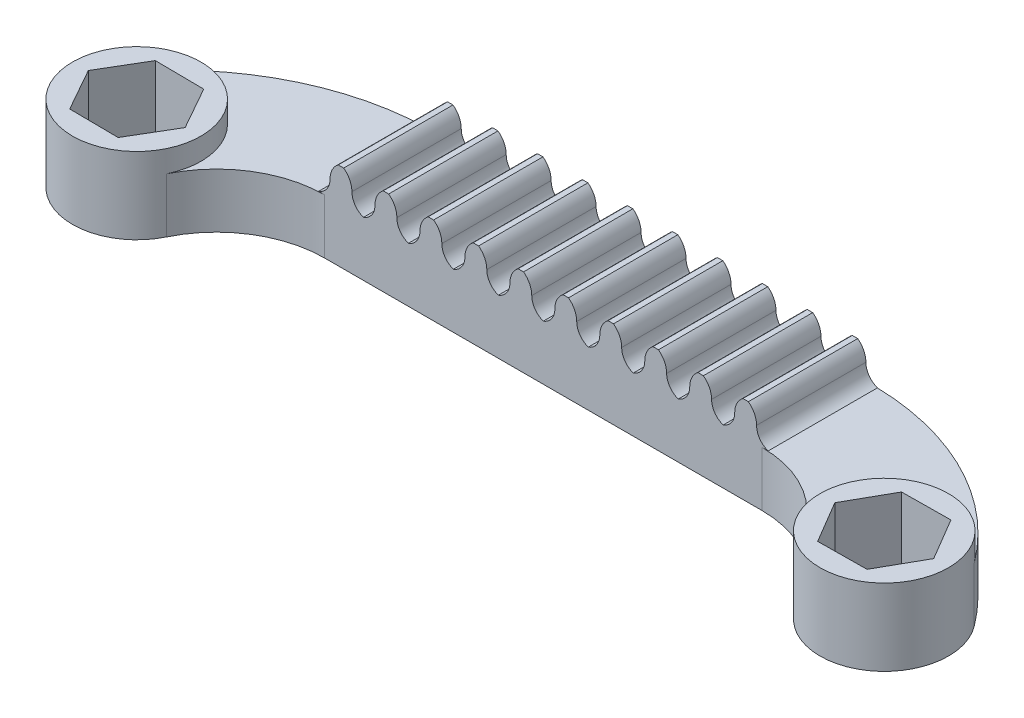
from build123d import *

# Parameters (mm, degrees)
BOSS_EXTRUDE1_DEPTH             = 5
BOSS_EXTRUDE2_REACH             = 44.693
SKETCH2_W                       = 1
SKETCH2_H                       = 1.5
BOSS_EXTRUDE2_DIRECTION_2_REACH = 44.693
LPATTERN1_COUNT                 = 10
LPATTERN1_PITCH                 = 4.112759299
BOSS_EXTRUDE3_START             = 5
BOSS_EXTRUDE3_OUTLINE_R         = 5.875
BOSS_EXTRUDE3_DEPTH             = 2


# Read off the part's stored shape, not the designer's step: Boss-Extrude3
with BuildPart() as part:
    # Sketch1 → Boss-Extrude1 (new body)
    with BuildSketch(Plane(origin=(0, 0, 0), x_dir=(1, 0, 0), z_dir=(0, 1, 0))):
        with BuildLine():
            ThreePointArc((-38.901886937, -4.490905174), (-37.243453661, -13.019167833), (-28.907471708, -10.571093123))
            ThreePointArc((-28.907471708, -10.571093123), (-25.253097439, -6.507468715), (-20, -5))
            Line((-20, -5), (20, -5))
            ThreePointArc((20, -5), (25.253097439, -6.507468715), (28.907471708, -10.571093123))
            ThreePointArc((28.907471708, -10.571093123), (37.243453661, -13.019167833), (38.901886937, -4.490905174))
            ThreePointArc((38.901886937, -4.490905174), (30.575426833, 2.494044808), (20, 5))
            Line((20, 5), (-20, 5))
            ThreePointArc((-20, 5), (-30.575426833, 2.494044808), (-38.901886937, -4.490905174))
        make_face()
        Polygon((-31.913207445, -4.148110984), (-30.814488671, -6.096963409), (-29.715769982, -8.045815684), (-31.992562537, -11.8977047), (-36.466792555, -11.851889016), (-38.664230018, -7.954184316), (-36.387437463, -4.1022953), align=None, mode=Mode.SUBTRACT)
        Polygon((30.814488669, -6.096963413), (31.913207445, -4.148110984), (36.387437463, -4.1022953), (38.664230018, -7.954184316), (36.466792555, -11.851889016), (31.992562537, -11.8977047), (29.715769982, -8.045815684), align=None, mode=Mode.SUBTRACT)
    extrude(amount=BOSS_EXTRUDE1_DEPTH)

    # Boss-Extrude2: up to this face of the body (flat: up to its plane)
    boss_extrude2_end = Plane(part.part.faces().sort_by_distance((0, 2.5, 5))[0])
    # Sketch2 → Boss-Extrude2 (add, up to the picked face)
    with BuildSketch(Plane.XY, mode=Mode.PRIVATE) as boss_extrude2_sk1:
        with BuildLine():
            ThreePointArc((-19.507416847, 6.5), (-19.798015047, 5.582675362), (-20.563796496, 5))
            Line((-20.563796496, 5), (-18.507416847, 5))
            Line((-18.507416847, 5), (-18.507416847, 6.5))
            Line((-18.507416847, 6.5), (-19.507416847, 6.5))
        make_face()
    boss_extrude2_tool1 = split(extrude(boss_extrude2_sk1.sketch, amount=BOSS_EXTRUDE2_REACH, mode=Mode.PRIVATE), bisect_by=boss_extrude2_end, keep=Keep.BOTH, mode=Mode.PRIVATE)
    # Sketch2 → Boss-Extrude2 (add, up to the picked face)
    with BuildSketch(Plane.XY, mode=Mode.PRIVATE) as boss_extrude2_sk2:
        with Locations((-18.007416847, 5.75)):
            Rectangle(SKETCH2_W, SKETCH2_H)
    boss_extrude2_tool2 = split(extrude(boss_extrude2_sk2.sketch, amount=BOSS_EXTRUDE2_REACH, mode=Mode.PRIVATE), bisect_by=boss_extrude2_end, keep=Keep.BOTH, mode=Mode.PRIVATE)
    # Sketch2 → Boss-Extrude2 (add, up to the picked face)
    with BuildSketch(Plane.XY, mode=Mode.PRIVATE) as boss_extrude2_sk3:
        with BuildLine():
            Line((-17.507416847, 6.5), (-17.507416847, 5))
            Line((-17.507416847, 5), (-16.451037197, 5))
            ThreePointArc((-16.451037197, 5), (-17.216818646, 5.582675362), (-17.507416847, 6.5))
        make_face()
    boss_extrude2_tool3 = split(extrude(boss_extrude2_sk3.sketch, amount=BOSS_EXTRUDE2_REACH, mode=Mode.PRIVATE), bisect_by=boss_extrude2_end, keep=Keep.BOTH, mode=Mode.PRIVATE)
    # Sketch2 → Boss-Extrude2 (add, up to the picked face)
    with BuildSketch(Plane.XY, mode=Mode.PRIVATE) as boss_extrude2_sk4:
        with BuildLine():
            Line((-18.507416847, 8), (-18.507416847, 6.5))
            Line((-18.507416847, 6.5), (-17.507416847, 6.5))
            ThreePointArc((-17.507416847, 6.5), (-17.705365863, 7.338525492), (-18.257416847, 8))
            Line((-18.257416847, 8), (-18.507416847, 8))
        make_face()
    boss_extrude2_tool4 = split(extrude(boss_extrude2_sk4.sketch, amount=BOSS_EXTRUDE2_REACH, mode=Mode.PRIVATE), bisect_by=boss_extrude2_end, keep=Keep.BOTH, mode=Mode.PRIVATE)
    # Sketch2 → Boss-Extrude2 (add, up to the picked face)
    with BuildSketch(Plane.XY, mode=Mode.PRIVATE) as boss_extrude2_sk5:
        with BuildLine():
            ThreePointArc((-18.757416847, 8), (-19.30946783, 7.338525492), (-19.507416847, 6.5))
            Line((-19.507416847, 6.5), (-18.507416847, 6.5))
            Line((-18.507416847, 6.5), (-18.507416847, 8))
            Line((-18.507416847, 8), (-18.757416847, 8))
        make_face()
    boss_extrude2_tool5 = split(extrude(boss_extrude2_sk5.sketch, amount=BOSS_EXTRUDE2_REACH, mode=Mode.PRIVATE), bisect_by=boss_extrude2_end, keep=Keep.BOTH, mode=Mode.PRIVATE)
    boss_extrude2_1 = boss_extrude2_tool1.solids().sort_by(Axis((-19.182136, 5.660038, 0), (0, 0, 1)))[0]
    add(boss_extrude2_1)
    boss_extrude2_2 = boss_extrude2_tool2.solids().sort_by(Axis((-18.007417, 5.75, 0), (0, 0, 1)))[0]
    add(boss_extrude2_2)
    boss_extrude2_3 = boss_extrude2_tool3.solids().sort_by(Axis((-17.222958, 5.346083, 0), (0, 0, 1)))[0]
    add(boss_extrude2_3)
    boss_extrude2_4 = boss_extrude2_tool4.solids().sort_by(Axis((-18.090718, 7.135758, 0), (0, 0, 1)))[0]
    add(boss_extrude2_4)
    boss_extrude2_5 = boss_extrude2_tool5.solids().sort_by(Axis((-18.924116, 7.135758, 0), (0, 0, 1)))[0]
    add(boss_extrude2_5)
    boss_extrude2 = boss_extrude2_1 + boss_extrude2_2 + boss_extrude2_3 + boss_extrude2_4 + boss_extrude2_5  # Boss-Extrude2 as one shape, for the pattern or mirror that repeats it

    # Boss-Extrude2 direction 2: up to this face of the body (flat: up to its plane)
    boss_extrude2_direction_2_end = Plane(part.part.faces().sort_by_distance((0, 2.5, -5))[0])
    # Sketch2 → Boss-Extrude2 direction 2 (add, up to the picked face)
    with BuildSketch(Plane.XY, mode=Mode.PRIVATE) as boss_extrude2_direction_2_sk1:
        with BuildLine():
            ThreePointArc((-19.507416847, 6.5), (-19.798015047, 5.582675362), (-20.563796496, 5))
            Line((-20.563796496, 5), (-18.507416847, 5))
            Line((-18.507416847, 5), (-18.507416847, 6.5))
            Line((-18.507416847, 6.5), (-19.507416847, 6.5))
        make_face()
    boss_extrude2_direction_2_tool1 = split(extrude(boss_extrude2_direction_2_sk1.sketch, amount=-BOSS_EXTRUDE2_DIRECTION_2_REACH, mode=Mode.PRIVATE), bisect_by=boss_extrude2_direction_2_end, keep=Keep.BOTH, mode=Mode.PRIVATE)
    # Sketch2 → Boss-Extrude2 direction 2 (add, up to the picked face)
    with BuildSketch(Plane.XY, mode=Mode.PRIVATE) as boss_extrude2_direction_2_sk2:
        with Locations((-18.007416847, 5.75)):
            Rectangle(SKETCH2_W, SKETCH2_H)
    boss_extrude2_direction_2_tool2 = split(extrude(boss_extrude2_direction_2_sk2.sketch, amount=-BOSS_EXTRUDE2_DIRECTION_2_REACH, mode=Mode.PRIVATE), bisect_by=boss_extrude2_direction_2_end, keep=Keep.BOTH, mode=Mode.PRIVATE)
    # Sketch2 → Boss-Extrude2 direction 2 (add, up to the picked face)
    with BuildSketch(Plane.XY, mode=Mode.PRIVATE) as boss_extrude2_direction_2_sk3:
        with BuildLine():
            Line((-17.507416847, 6.5), (-17.507416847, 5))
            Line((-17.507416847, 5), (-16.451037197, 5))
            ThreePointArc((-16.451037197, 5), (-17.216818646, 5.582675362), (-17.507416847, 6.5))
        make_face()
    boss_extrude2_direction_2_tool3 = split(extrude(boss_extrude2_direction_2_sk3.sketch, amount=-BOSS_EXTRUDE2_DIRECTION_2_REACH, mode=Mode.PRIVATE), bisect_by=boss_extrude2_direction_2_end, keep=Keep.BOTH, mode=Mode.PRIVATE)
    # Sketch2 → Boss-Extrude2 direction 2 (add, up to the picked face)
    with BuildSketch(Plane.XY, mode=Mode.PRIVATE) as boss_extrude2_direction_2_sk4:
        with BuildLine():
            Line((-18.507416847, 8), (-18.507416847, 6.5))
            Line((-18.507416847, 6.5), (-17.507416847, 6.5))
            ThreePointArc((-17.507416847, 6.5), (-17.705365863, 7.338525492), (-18.257416847, 8))
            Line((-18.257416847, 8), (-18.507416847, 8))
        make_face()
    boss_extrude2_direction_2_tool4 = split(extrude(boss_extrude2_direction_2_sk4.sketch, amount=-BOSS_EXTRUDE2_DIRECTION_2_REACH, mode=Mode.PRIVATE), bisect_by=boss_extrude2_direction_2_end, keep=Keep.BOTH, mode=Mode.PRIVATE)
    # Sketch2 → Boss-Extrude2 direction 2 (add, up to the picked face)
    with BuildSketch(Plane.XY, mode=Mode.PRIVATE) as boss_extrude2_direction_2_sk5:
        with BuildLine():
            ThreePointArc((-18.757416847, 8), (-19.30946783, 7.338525492), (-19.507416847, 6.5))
            Line((-19.507416847, 6.5), (-18.507416847, 6.5))
            Line((-18.507416847, 6.5), (-18.507416847, 8))
            Line((-18.507416847, 8), (-18.757416847, 8))
        make_face()
    boss_extrude2_direction_2_tool5 = split(extrude(boss_extrude2_direction_2_sk5.sketch, amount=-BOSS_EXTRUDE2_DIRECTION_2_REACH, mode=Mode.PRIVATE), bisect_by=boss_extrude2_direction_2_end, keep=Keep.BOTH, mode=Mode.PRIVATE)
    boss_extrude2_direction_2_1 = boss_extrude2_direction_2_tool1.solids().sort_by(Axis((-19.182136, 5.660038, 0), (0, 0, -1)))[0]
    add(boss_extrude2_direction_2_1)
    boss_extrude2_direction_2_2 = boss_extrude2_direction_2_tool2.solids().sort_by(Axis((-18.007417, 5.75, 0), (0, 0, -1)))[0]
    add(boss_extrude2_direction_2_2)
    boss_extrude2_direction_2_3 = boss_extrude2_direction_2_tool3.solids().sort_by(Axis((-17.222958, 5.346083, 0), (0, 0, -1)))[0]
    add(boss_extrude2_direction_2_3)
    boss_extrude2_direction_2_4 = boss_extrude2_direction_2_tool4.solids().sort_by(Axis((-18.090718, 7.135758, 0), (0, 0, -1)))[0]
    add(boss_extrude2_direction_2_4)
    boss_extrude2_direction_2_5 = boss_extrude2_direction_2_tool5.solids().sort_by(Axis((-18.924116, 7.135758, 0), (0, 0, -1)))[0]
    add(boss_extrude2_direction_2_5)
    boss_extrude2_direction_2 = boss_extrude2_direction_2_1 + boss_extrude2_direction_2_2 + boss_extrude2_direction_2_3 + boss_extrude2_direction_2_4 + boss_extrude2_direction_2_5  # Boss-Extrude2 direction 2 as one shape, for the pattern or mirror that repeats it

    # LPattern1: Boss-Extrude2, Boss-Extrude2 direction 2 ×10
    with Locations(*[(i * LPATTERN1_PITCH, 0, 0) for i in range(1, LPATTERN1_COUNT)]):
        add(boss_extrude2)
        add(boss_extrude2_direction_2)

    # Boss-Extrude3 outline → Boss-Extrude3 (add)
    # profile 1 of 2: a face of its own
    with BuildSketch(Plane(origin=(0, 0, 0), x_dir=(1, 0, 0), z_dir=(0, 1, 0)).offset(BOSS_EXTRUDE3_START)):
        with Locations((34.19, -8)):
            Circle(BOSS_EXTRUDE3_OUTLINE_R)
        Polygon((36.466792555, -11.851889016), (31.992562537, -11.8977047), (29.715769982, -8.045815684), (31.913207445, -4.148110984), (36.387437463, -4.1022953), (38.664230018, -7.954184316), align=None, mode=Mode.SUBTRACT)
    # profile 2 of 2: a face of its own
    with BuildSketch(Plane(origin=(0, 0, 0), x_dir=(1, 0, 0), z_dir=(0, 1, 0)).offset(BOSS_EXTRUDE3_START)):
        with Locations((-34.19, -8)):
            Circle(BOSS_EXTRUDE3_OUTLINE_R)
        Polygon((-38.664230018, -7.954184316), (-36.387437463, -4.1022953), (-31.913207445, -4.148110984), (-29.715769982, -8.045815684), (-31.992562537, -11.8977047), (-36.466792555, -11.851889016), align=None, mode=Mode.SUBTRACT)
    extrude(amount=BOSS_EXTRUDE3_DEPTH)


solid = part.part
